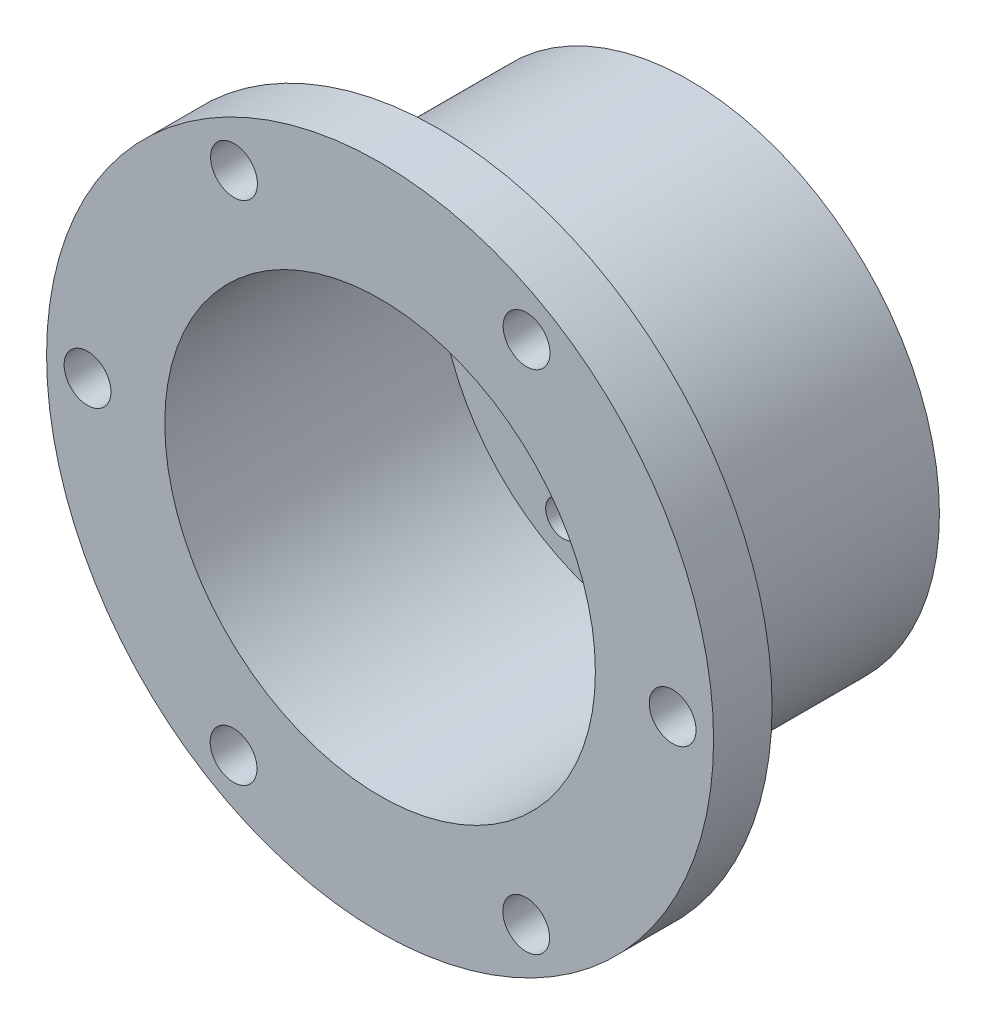
from build123d import *

# Parameters (mm, degrees)
CROQUIS1_R              = 21.4
CROQUIS1_R_2            = 18.4
SALIENTE_EXTRUIR1_DEPTH = 26.4
CROQUIS2_R              = 18.65
SALIENTE_EXTRUIR2_DEPTH = 3
SALIENTE_EXTRUIR3_START = -5
CROQUIS3_R              = 28.5
CROQUIS3_R_2            = 21.4
SALIENTE_EXTRUIR3_DEPTH = 5
CROQUIS4_R              = 6
CROQUIS4_R_2            = 1.5
CORTAR_EXTRUIR1_DEPTH   = 3
CROQUIS6_R              = 2
CORTAR_EXTRUIR2_DEPTH   = 49.181531732


with BuildPart() as part:
    # Croquis1 → Saliente-Extruir1 (new body)
    with BuildSketch(Plane.XY):
        Circle(CROQUIS1_R)
        Circle(CROQUIS1_R_2, mode=Mode.SUBTRACT)
    extrude(amount=SALIENTE_EXTRUIR1_DEPTH)

    # Croquis2 → Saliente-Extruir2 (add)
    with BuildSketch(Plane(origin=(0, 0, 0), x_dir=(-1, 0, 0), z_dir=(0, 0, -1))):
        Circle(CROQUIS2_R)
    extrude(amount=-SALIENTE_EXTRUIR2_DEPTH)

    # Croquis3 → Saliente-Extruir3 (add)
    with BuildSketch(Plane.XY.offset(26.4).offset(SALIENTE_EXTRUIR3_START)):
        Circle(CROQUIS3_R)
        Circle(CROQUIS3_R_2, mode=Mode.SUBTRACT)
    extrude(amount=SALIENTE_EXTRUIR3_DEPTH)

    # Croquis4 → Cortar-Extruir1 (cut)
    with BuildSketch(Plane(origin=(0, 0, 0), x_dir=(-1, 0, 0), z_dir=(0, 0, -1))):
        with Locations((0, -7)):
            Circle(CROQUIS4_R)
        with Locations((-15.5, 0)):
            Circle(CROQUIS4_R_2)
        with Locations((-7.75, 13.423393759)):
            Circle(CROQUIS4_R_2)
        with Locations((7.75, 13.423393759)):
            Circle(CROQUIS4_R_2)
        with Locations((15.5, 0)):
            Circle(CROQUIS4_R_2)
        with Locations((7.75, -13.423393759)):
            Circle(CROQUIS4_R_2)
        with Locations((-7.75, -13.423393759)):
            Circle(CROQUIS4_R_2)
    extrude(amount=-CORTAR_EXTRUIR1_DEPTH, mode=Mode.SUBTRACT)

    # Croquis6 → Cortar-Extruir2 (cut, through all)
    with BuildSketch(Plane.XY.offset(26.4)):
        with Locations((12.516711685, 21.640977996)):
            Circle(CROQUIS6_R)
        with Locations((24.999992549, -0.019301293)):
            Circle(CROQUIS6_R)
        with Locations((-12.483280865, 21.660279288)):
            Circle(CROQUIS6_R)
        with Locations((12.483280865, -21.660279288)):
            Circle(CROQUIS6_R)
        with Locations((-12.516711685, -21.640977996)):
            Circle(CROQUIS6_R)
        with Locations((-24.999992549, 0.019301293)):
            Circle(CROQUIS6_R)
    extrude(amount=-CORTAR_EXTRUIR2_DEPTH, mode=Mode.SUBTRACT)


solid = part.part
